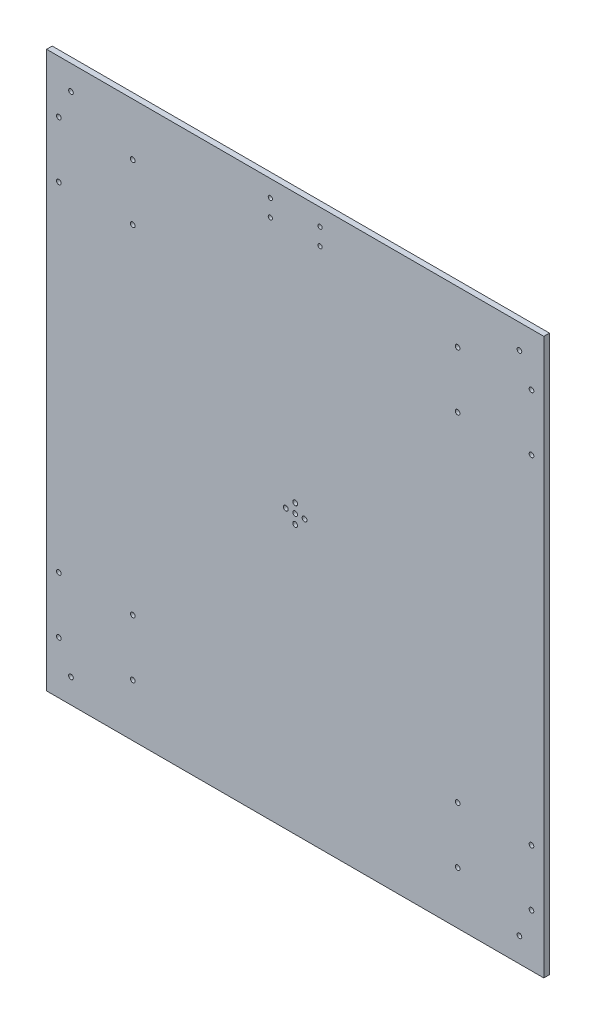
from build123d import *

# Parameters (mm, degrees)
SKETCH_3_W                  = 530
SKETCH_3_H                  = 592.3
SKETCH_3_R                  = 2.55
EXTRUDE_1_DEPTH             = 6
SKETCH_4_R                  = 2.5
CUT_EXTRUDE_1_DEPTH         = 398.449144546
PATTERN_LINEAR_1_COUNT      = 2
PATTERN_LINEAR_1_PITCH      = 478
PATTERN_LINEAR_1_COUNT_DIR2 = 2
PATTERN_LINEAR_1_PITCH_DIR2 = 540.3
SKETCH_7_R                  = 2.25
CUT_EXTRUDE_2_DEPTH         = 398.449144546
SKETCH_8_R                  = 2.5
CUT_EXTRUDE_3_DEPTH         = 398.449144546
PATTERN_LINEAR_2_COUNT      = 2
PATTERN_LINEAR_2_PITCH      = 420.3
PATTERN_LINEAR_2_COUNT_DIR2 = 2
PATTERN_LINEAR_2_PITCH_DIR2 = 424.995


with BuildPart() as part:
    # Эскиз3 → Бобышка-Вытянуть1 (new body)
    with BuildSketch(Plane.XY):
        Rectangle(SKETCH_3_W, SKETCH_3_H)
        Circle(SKETCH_3_R, mode=Mode.SUBTRACT)
        with Locations((0, 10)):
            Circle(SKETCH_3_R, mode=Mode.SUBTRACT)
        with Locations((10, 0)):
            Circle(SKETCH_3_R, mode=Mode.SUBTRACT)
        with Locations((0, -10)):
            Circle(SKETCH_3_R, mode=Mode.SUBTRACT)
        with Locations((-10, 0)):
            Circle(SKETCH_3_R, mode=Mode.SUBTRACT)
    extrude(amount=EXTRUDE_1_DEPTH)

    # Эскиз4 → Вырез-Вытянуть1 (cut, through all)
    with BuildSketch(Plane.XY.offset(6)):
        with Locations((-239, 270.15)):
            Circle(SKETCH_4_R)
    cut_extrude_1 = extrude(amount=-CUT_EXTRUDE_1_DEPTH, mode=Mode.SUBTRACT)

    # Линейный массив1: Cut-Extrude 1 2 × 2
    with Locations(*[(i * PATTERN_LINEAR_1_PITCH, -j * PATTERN_LINEAR_1_PITCH_DIR2, 0) for i in range(PATTERN_LINEAR_1_COUNT) for j in range(PATTERN_LINEAR_1_COUNT_DIR2) if (i, j) != (0, 0)]):
        add(cut_extrude_1, mode=Mode.SUBTRACT)

    # Эскиз7 → Вырез-Вытянуть2 (cut, through all)
    with BuildSketch(Plane(origin=(0, 0, 0), x_dir=(-1, 0, 0), z_dir=(0, 0, -1))):
        with Locations((-26.5, 278.15)):
            Circle(SKETCH_7_R)
        with Locations((26.5, 278.15)):
            Circle(SKETCH_7_R)
        with Locations((-26.5, 260.15)):
            Circle(SKETCH_7_R)
        with Locations((26.5, 260.15)):
            Circle(SKETCH_7_R)
    extrude(amount=-CUT_EXTRUDE_2_DEPTH, mode=Mode.SUBTRACT)

    # Эскиз8 → Вырез-Вытянуть3 (cut, through all)
    with BuildSketch(Plane(origin=(0, 0, 0), x_dir=(-1, 0, 0), z_dir=(0, 0, -1))):
        with Locations((173.125, 180.15)):
            Circle(SKETCH_8_R)
        with Locations((173.125, 240.15)):
            Circle(SKETCH_8_R)
        with Locations((251.875, 240.15)):
            Circle(SKETCH_8_R)
        with Locations((251.875, 180.15)):
            Circle(SKETCH_8_R)
    cut_extrude_3 = extrude(amount=-CUT_EXTRUDE_3_DEPTH, mode=Mode.SUBTRACT)

    # Линейный массив2: Cut-Extrude 3 2 × 2
    with Locations(*[(j * PATTERN_LINEAR_2_PITCH_DIR2, -i * PATTERN_LINEAR_2_PITCH, 0) for i in range(PATTERN_LINEAR_2_COUNT) for j in range(PATTERN_LINEAR_2_COUNT_DIR2) if (i, j) != (0, 0)]):
        add(cut_extrude_3, mode=Mode.SUBTRACT)


solid = part.part
